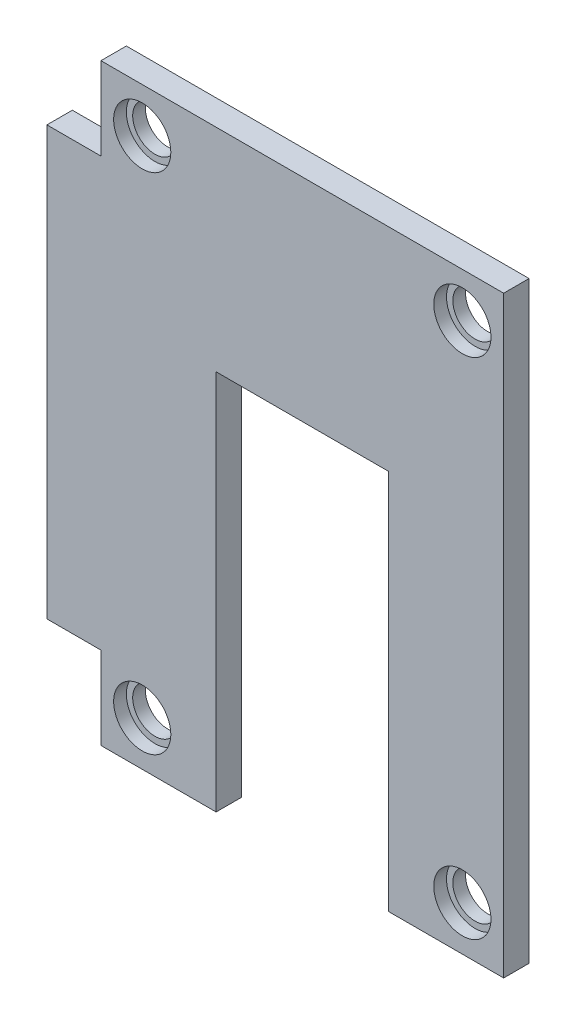
from build123d import *

# Parameters (mm, degrees)
CROQUIS1_W                 = 64.38677758
CROQUIS1_H                 = 93.345
SALIENTE_EXTRUIR1_DEPTH    = 4
CROQUIS2_W                 = 27.12677758
CROQUIS2_H                 = 60
CORTAR_EXTRUIR1_DEPTH      = 114.467819897
CROQUIS5_R                 = 4.5
CORTAR_EXTRUIR3_DEPTH      = 2
CROQUIS6_R                 = 3.5
CORTAR_EXTRUIR4_DEPTH      = 114.414929141
CROQUIS7_W                 = 8
CROQUIS7_H                 = 67.345
SALIENTE_EXTRUIR4_DEPTH    = 4
CROQUIS8_W                 = 26.63
CROQUIS8_H                 = 67.345
SALIENTE_EXTRUIR5_DEPTH    = 2
CROQUIS9_W                 = 0.5
CROQUIS9_H                 = 93.345
CROQUIS9_H_2               = 13
CORTAR_EXTRUIR5_DEPTH      = 13
CROQUIS10_W                = 5
CROQUIS10_H                = 20
SALIENTE_EXTRUIR6_DEPTH    = 25
REDONDEO1_R                = 1
REDONDEO2_START            = -8.0000001
REDONDEO2_DEPTH            = 6.0000001
REDONDEO2_START_2          = 13
REDONDEO2_2_DEPTH          = 67.345
CORTAR_EXTRUIR6_DEPTH      = 120.846669794
CORTAR_EXTRUIR6_DEPTH_BACK = 120.846669794
CROQUIS11_R                = 1.5


with BuildPart() as part:
    # Croquis1 → Saliente-Extruir1 (new body)
    with BuildSketch(Plane.XY):
        with Locations((32.19338879, 46.6725)):
            Rectangle(CROQUIS1_W, CROQUIS1_H)
    extrude(amount=SALIENTE_EXTRUIR1_DEPTH)

    # Croquis2 → Cortar-Extruir1 (cut, through all)
    with BuildSketch(Plane.XY.offset(4)):
        with Locations((32.19338879, 30)):
            Rectangle(CROQUIS2_W, CROQUIS2_H)
    extrude(amount=-CORTAR_EXTRUIR1_DEPTH, mode=Mode.SUBTRACT)

    # Croquis5 → Cortar-Extruir3 (cut)
    with BuildSketch(Plane.XY.offset(4)):
        with Locations((57.38677758, 86.345)):
            Circle(CROQUIS5_R)
        with Locations((7, 86.345)):
            Circle(CROQUIS5_R)
        with Locations((57.38677758, 7)):
            Circle(CROQUIS5_R)
        with Locations((7, 7)):
            Circle(CROQUIS5_R)
    extrude(amount=-CORTAR_EXTRUIR3_DEPTH, mode=Mode.SUBTRACT)

    # Croquis6 → Cortar-Extruir4 (cut, through all)
    with BuildSketch(Plane.XY.offset(2)):
        with Locations((7, 86.345)):
            Circle(CROQUIS6_R)
        with Locations((57.38677758, 86.345)):
            Circle(CROQUIS6_R)
        with Locations((57.38677758, 7)):
            Circle(CROQUIS6_R)
        with Locations((7, 7)):
            Circle(CROQUIS6_R)
    extrude(amount=-CORTAR_EXTRUIR4_DEPTH, mode=Mode.SUBTRACT)

    # Croquis7 → Saliente-Extruir4 (add, through all)
    with BuildSketch(Plane(origin=(0, 0, 0), x_dir=(-1, 0, 0), z_dir=(0, 0, -1))):
        with Locations((4, 46.6725)):
            Rectangle(CROQUIS7_W, CROQUIS7_H)
    extrude(amount=-SALIENTE_EXTRUIR4_DEPTH)

    # Croquis8 → Saliente-Extruir5 (add)
    with BuildSketch(Plane(origin=(0, 0, 0), x_dir=(-1, 0, 0), z_dir=(0, 0, -1))):
        with Locations((-5.315, 46.6725)):
            Rectangle(CROQUIS8_W, CROQUIS8_H)
    extrude(amount=-SALIENTE_EXTRUIR5_DEPTH)

    # Croquis9 → Cortar-Extruir5 (cut)
    with BuildSketch(Plane(origin=(0, 0, 0), x_dir=(-1, 0, 0), z_dir=(0, 0, -1))):
        with Locations((-64.13677758, 46.6725)):
            Rectangle(CROQUIS9_W, CROQUIS9_H)
        with Locations((-0.25, 86.845)):
            Rectangle(CROQUIS9_W, CROQUIS9_H_2)
        with Locations((-0.25, 6.5)):
            Rectangle(CROQUIS9_W, CROQUIS9_H_2)
    extrude(amount=-CORTAR_EXTRUIR5_DEPTH, mode=Mode.SUBTRACT)

    # Croquis10 → Saliente-Extruir6 (add)
    with BuildSketch(Plane(origin=(0, 0, 0), x_dir=(-1, 0, 0), z_dir=(0, 0, -1))):
        with Locations((4.5, 46.345)):
            Rectangle(CROQUIS10_W, CROQUIS10_H)
    extrude(amount=SALIENTE_EXTRUIR6_DEPTH)

    # Redondeo1
    redondeo1_edges = [part.edges().sort_by_distance(p)[0] for p in [
        (-7, 46.345, 0),
    ]]
    fillet(redondeo1_edges, radius=REDONDEO1_R - 0.0001)  # a hair under: the kernel refuses the full size

    # Redondeo2: read off the stored shape, not the designer's step
    # Redondeo2 outline → Redondeo2 (add)
    with BuildSketch(Plane.YZ.offset(REDONDEO2_START)):
        with BuildLine():
            Line((56.345, 0), (56.345, -5))
            ThreePointArc((56.345, -5), (57.809466094, -1.464466094), (61.345, 0))
            Line((61.345, 0), (56.345, 0))
        make_face()
        with BuildLine():
            Line((36.345, -5), (36.345, 0))
            Line((36.345, 0), (31.345, 0))
            ThreePointArc((31.345, 0), (34.880533906, -1.464466094), (36.345, -5))
        make_face()
    extrude(amount=REDONDEO2_DEPTH)

    # Redondeo2 2 outline → Redondeo2 2 (cut)
    with BuildSketch(Plane(origin=(0, 0, 0), x_dir=(1, 0, 0), z_dir=(0, 1, 0)).offset(REDONDEO2_START_2)):
        with BuildLine():
            ThreePointArc((-8, 0), (-7.292893219, 0.292893219), (-7, 1))
            Line((-7, 1), (-6.999999997, 6))
            Line((-6.999999997, 6), (-8, 6))
            Line((-8, 6), (-8, 0))
        make_face()
    extrude(amount=REDONDEO2_2_DEPTH, mode=Mode.SUBTRACT)

    # Croquis11 → Cortar-Extruir6 (cut, two sides: drawn at the far end of the back side and taken through both)
    with BuildSketch(Plane.ZY.offset(7).offset(-CORTAR_EXTRUIR6_DEPTH_BACK)):
        with Locations(Location((-19.75, 46.345, 0), (0, 0, 270))):
            Circle(CROQUIS11_R)
        with Locations(Location((-2.25, 46.345, 0), (0, 0, 270))):
            Circle(CROQUIS11_R)
    extrude(amount=CORTAR_EXTRUIR6_DEPTH + CORTAR_EXTRUIR6_DEPTH_BACK, mode=Mode.SUBTRACT)


solid = part.part
